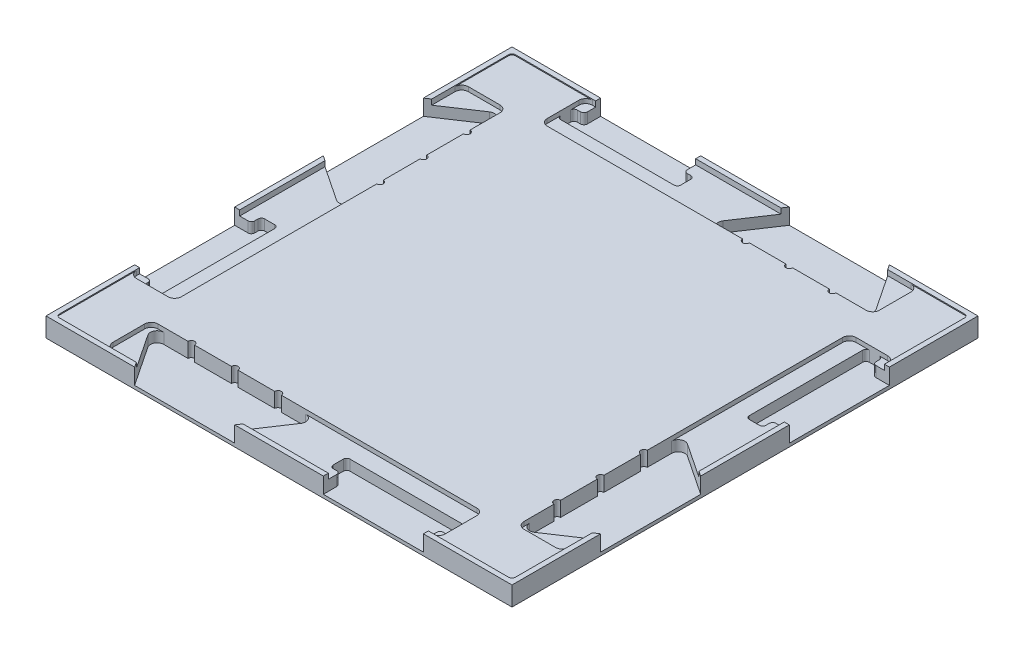
from build123d import *

# Parameters (mm, degrees)
SKETCH1_W           = 139.7
SKETCH1_H           = 139.7
BOSS_EXTRUDE1_DEPTH = 2.875
SKETCH2_W           = 136.7
SKETCH2_H           = 136.7
CUT_EXTRUDE1_DEPTH  = 0.3
CUT_EXTRUDE2_START  = -4.75
CUT_EXTRUDE2_DEPTH  = 104.700025265
CUT_EXTRUDE4_DEPTH  = 4.45
SKETCH9_W           = 99.566666666
SKETCH9_H           = 13.5
CUT_EXTRUDE5_DEPTH  = 1.3
FILLET1_R           = 1
FILLET3_R           = 2
FILLET4_R           = 2
CIRPATTERN1_START   = -1.875
CIRPATTERN1_DEPTH   = 4.75
CIRPATTERN1_START_2 = 1.275
CIRPATTERN1_2_DEPTH = 1.3


# Read off the part's stored shape, not the designer's step: CirPattern1
with BuildPart() as part:
    # Sketch1 → Boss-Extrude1 (new, symmetric)
    with BuildSketch(Plane(origin=(0, 0, 0), x_dir=(1, 0, 0), z_dir=(0, 1, 0))):
        Rectangle(SKETCH1_W, SKETCH1_H)
    extrude(amount=BOSS_EXTRUDE1_DEPTH, both=True)

    # Sketch2 → Cut-Extrude1 (cut)
    with BuildSketch(Plane(origin=(0, 2.875, 0), x_dir=(1, 0, 0), z_dir=(0, 1, 0))):
        Rectangle(SKETCH2_W, SKETCH2_H)
    extrude(amount=-CUT_EXTRUDE1_DEPTH, mode=Mode.SUBTRACT)

    # Sketch4 → Cut-Extrude2 (cut)
    with BuildSketch(Plane(origin=(0, 2.875, 0), x_dir=(1, 0, 0), z_dir=(0, 1, 0)).offset(CUT_EXTRUDE2_START)):
        Polygon((-43.283333333, -69.85), (-53.283333333, -54.85), (-3.283333333, -54.85), (-13.283333333, -69.85), align=None)
        Polygon((13.283333333, -69.85), (13.283333333, -64.85), (10.283333333, -64.85), (10.283333333, -59.85), (46.283333333, -59.85), (46.283333333, -64.85), (43.283333333, -64.85), (43.283333333, -69.85), align=None)
    extrude(amount=CUT_EXTRUDE2_DEPTH, mode=Mode.SUBTRACT)

    # Sketch6 → Cut-Extrude4 (cut)
    with BuildSketch(Plane(origin=(0, 2.575, 0), x_dir=(1, 0, 0), z_dir=(0, 1, 0))):
        with BuildLine():
            Line((-42.283333333, -54.85), (-40.283333333, -54.85))
            ThreePointArc((-40.283333333, -54.85), (-41.283333333, -53.85), (-42.283333333, -54.85))
        make_face()
        with BuildLine():
            Line((-29.283333333, -54.85), (-27.283333333, -54.85))
            ThreePointArc((-27.283333333, -54.85), (-28.283333333, -53.85), (-29.283333333, -54.85))
        make_face()
        with BuildLine():
            Line((-16.283333333, -54.85), (-14.283333333, -54.85))
            ThreePointArc((-14.283333333, -54.85), (-15.283333333, -53.85), (-16.283333333, -54.85))
        make_face()
    extrude(amount=-CUT_EXTRUDE4_DEPTH, mode=Mode.SUBTRACT)

    # Sketch9 → Cut-Extrude5 (cut)
    with BuildSketch(Plane(origin=(0, 2.575, 0), x_dir=(1, 0, 0), z_dir=(0, 1, 0))):
        with Locations((-3.5, -61.6)):
            Rectangle(SKETCH9_W, SKETCH9_H)
    extrude(amount=-CUT_EXTRUDE5_DEPTH, mode=Mode.SUBTRACT)

    # Fillet1
    fillet1_edges = [part.edges().sort_by_distance(p)[0] for p in [
        (-68.35, 2.725, -68.35),
        (-68.35, 2.725, 68.35),
        (68.35, 2.725, 68.35),
        (68.35, 2.725, -68.35),
        (46.283333333, -0.3, 64.85),
        (46.283333333, -0.3, 59.85),
        (10.283333333, -0.3, 59.85),
        (10.283333333, -0.3, 64.85),
        (13.283333333, -0.3, 64.85),
        (43.283333333, -0.3, 64.85),
    ]]
    fillet(fillet1_edges, radius=FILLET1_R)

    # Fillet3
    fillet3_edges = [part.edges().sort_by_distance(p)[0] for p in [
        (-53.283333333, -0.3, 54.85),
        (-3.283333333, -0.3, 54.85),
    ]]
    fillet(fillet3_edges, radius=FILLET3_R)

    # Fillet4
    fillet4_edges = [part.edges().sort_by_distance(p)[0] for p in [
        (46.283333333, 1.925, 54.85),
        (46.283333333, 1.925, 68.35),
        (-53.283333333, 1.925, 54.85),
        (-53.283333333, 1.925, 68.35),
    ]]
    fillet(fillet4_edges, radius=FILLET4_R)

    # CirPattern1 outline → CirPattern1 (cut)
    with BuildSketch(Plane(origin=(0, 0, 0), x_dir=(1, 0, 0), z_dir=(0, 1, 0)).offset(CIRPATTERN1_START)):
        with BuildLine():
            ThreePointArc((54.85, -14.283333333), (53.85, -15.283333333), (54.85, -16.283333333))
            Line((54.85, -16.283333333), (54.85, -27.283333333))
            ThreePointArc((54.85, -27.283333333), (53.85, -28.283333333), (54.85, -29.283333333))
            Line((54.85, -29.283333333), (54.85, -40.283333333))
            ThreePointArc((54.85, -40.283333333), (53.85, -41.283333333), (54.85, -42.283333333))
            Line((54.85, -42.283333333), (54.85, -49.54629915))
            ThreePointArc((54.85, -49.54629915), (55.906284149, -51.309648347), (57.959400392, -51.210399738))
            Line((57.959400392, -51.210399738), (69.85, -43.283333333))
            Line((69.85, -43.283333333), (69.85, -13.283333333))
            Line((69.85, -13.283333333), (57.959400392, -5.356266928))
            ThreePointArc((57.959400392, -5.356266928), (55.906284149, -5.257018319), (54.85, -7.020367517))
            Line((54.85, -7.020367517), (54.85, -14.283333333))
        make_face()
        with BuildLine():
            Line((-69.85, 43.283333333), (-69.85, 13.283333333))
            Line((-69.85, 13.283333333), (-57.959400392, 5.356266928))
            ThreePointArc((-57.959400392, 5.356266928), (-55.906284149, 5.257018319), (-54.85, 7.020367517))
            Line((-54.85, 7.020367517), (-54.85, 14.283333333))
            ThreePointArc((-54.85, 14.283333333), (-53.85, 15.283333333), (-54.85, 16.283333333))
            Line((-54.85, 16.283333333), (-54.85, 27.283333333))
            ThreePointArc((-54.85, 27.283333333), (-53.85, 28.283333333), (-54.85, 29.283333333))
            Line((-54.85, 29.283333333), (-54.85, 40.283333333))
            ThreePointArc((-54.85, 40.283333333), (-53.85, 41.283333333), (-54.85, 42.283333333))
            Line((-54.85, 42.283333333), (-54.85, 49.54629915))
            ThreePointArc((-54.85, 49.54629915), (-55.906284149, 51.309648347), (-57.959400392, 51.210399738))
            Line((-57.959400392, 51.210399738), (-69.85, 43.283333333))
        make_face()
        with BuildLine():
            Line((43.283333333, 69.85), (13.283333333, 69.85))
            Line((13.283333333, 69.85), (5.356266928, 57.959400392))
            ThreePointArc((5.356266928, 57.959400392), (5.257018319, 55.906284149), (7.020367517, 54.85))
            Line((7.020367517, 54.85), (14.283333333, 54.85))
            ThreePointArc((14.283333333, 54.85), (15.283333333, 53.85), (16.283333333, 54.85))
            Line((16.283333333, 54.85), (27.283333333, 54.85))
            ThreePointArc((27.283333333, 54.85), (28.283333333, 53.85), (29.283333333, 54.85))
            Line((29.283333333, 54.85), (40.283333333, 54.85))
            ThreePointArc((40.283333333, 54.85), (41.283333333, 53.85), (42.283333333, 54.85))
            Line((42.283333333, 54.85), (49.54629915, 54.85))
            ThreePointArc((49.54629915, 54.85), (51.309648347, 55.906284149), (51.210399738, 57.959400392))
            Line((51.210399738, 57.959400392), (43.283333333, 69.85))
        make_face()
        with BuildLine():
            Line((63.85, 46.283333333), (60.85, 46.283333333))
            ThreePointArc((60.85, 46.283333333), (60.142893218, 45.990440115), (59.85, 45.283333333))
            Line((59.85, 45.283333333), (59.85, 11.283333333))
            ThreePointArc((59.85, 11.283333333), (60.142893219, 10.576226552), (60.85, 10.283333333))
            Line((60.85, 10.283333333), (63.85, 10.283333333))
            ThreePointArc((63.85, 10.283333333), (64.557106781, 10.576226552), (64.85, 11.283333333))
            Line((64.85, 11.283333333), (64.85, 12.283333333))
            ThreePointArc((64.85, 12.283333333), (65.142893218, 12.990440114), (65.85, 13.283333333))
            Line((65.85, 13.283333333), (69.85, 13.283333333))
            Line((69.85, 13.283333333), (69.85, 43.283333333))
            Line((69.85, 43.283333333), (65.85, 43.283333333))
            ThreePointArc((65.85, 43.283333333), (65.142893219, 43.576226552), (64.85, 44.283333333))
            Line((64.85, 44.283333333), (64.85, 45.283333333))
            ThreePointArc((64.85, 45.283333333), (64.557106781, 45.990440115), (63.85, 46.283333333))
        make_face()
        with BuildLine():
            Line((-13.283333333, 69.85), (-43.283333333, 69.85))
            Line((-43.283333333, 69.85), (-43.283333333, 65.85))
            ThreePointArc((-43.283333333, 65.85), (-43.576226552, 65.142893219), (-44.283333333, 64.85))
            Line((-44.283333333, 64.85), (-45.283333333, 64.85))
            ThreePointArc((-45.283333333, 64.85), (-45.990440115, 64.557106781), (-46.283333333, 63.85))
            Line((-46.283333333, 63.85), (-46.283333333, 60.85))
            ThreePointArc((-46.283333333, 60.85), (-45.990440115, 60.142893218), (-45.283333333, 59.85))
            Line((-45.283333333, 59.85), (-11.283333333, 59.85))
            ThreePointArc((-11.283333333, 59.85), (-10.576226552, 60.142893219), (-10.283333333, 60.85))
            Line((-10.283333333, 60.85), (-10.283333333, 63.85))
            ThreePointArc((-10.283333333, 63.85), (-10.576226552, 64.557106781), (-11.283333333, 64.85))
            Line((-11.283333333, 64.85), (-12.283333333, 64.85))
            ThreePointArc((-12.283333333, 64.85), (-12.990440114, 65.142893218), (-13.283333333, 65.85))
            Line((-13.283333333, 65.85), (-13.283333333, 69.85))
        make_face()
        with BuildLine():
            Line((-69.85, -13.283333333), (-69.85, -43.283333333))
            Line((-69.85, -43.283333333), (-65.85, -43.283333333))
            ThreePointArc((-65.85, -43.283333333), (-65.142893219, -43.576226552), (-64.85, -44.283333333))
            Line((-64.85, -44.283333333), (-64.85, -45.283333333))
            ThreePointArc((-64.85, -45.283333333), (-64.557106781, -45.990440115), (-63.85, -46.283333333))
            Line((-63.85, -46.283333333), (-60.85, -46.283333333))
            ThreePointArc((-60.85, -46.283333333), (-60.142893218, -45.990440115), (-59.85, -45.283333333))
            Line((-59.85, -45.283333333), (-59.85, -11.283333333))
            ThreePointArc((-59.85, -11.283333333), (-60.142893219, -10.576226552), (-60.85, -10.283333333))
            Line((-60.85, -10.283333333), (-63.85, -10.283333333))
            ThreePointArc((-63.85, -10.283333333), (-64.557106781, -10.576226552), (-64.85, -11.283333333))
            Line((-64.85, -11.283333333), (-64.85, -12.283333333))
            ThreePointArc((-64.85, -12.283333333), (-65.142893218, -12.990440114), (-65.85, -13.283333333))
            Line((-65.85, -13.283333333), (-69.85, -13.283333333))
        make_face()
    extrude(amount=CIRPATTERN1_DEPTH, mode=Mode.SUBTRACT)

    # CirPattern1 2 outline → CirPattern1 2 (cut)
    with BuildSketch(Plane(origin=(0, 0, 0), x_dir=(1, 0, 0), z_dir=(0, 1, 0)).offset(CIRPATTERN1_START_2)):
        with BuildLine():
            Line((54.85, 44.283333333), (54.85, -7.020367517))
            ThreePointArc((54.85, -7.020367517), (55.906284149, -5.257018319), (57.959400392, -5.356266928))
            Line((57.959400392, -5.356266928), (68.35, -12.283333333))
            Line((68.35, -12.283333333), (68.35, 13.283333333))
            Line((68.35, 13.283333333), (65.85, 13.283333333))
            ThreePointArc((65.85, 13.283333333), (65.142893218, 12.990440114), (64.85, 12.283333333))
            Line((64.85, 12.283333333), (64.85, 11.283333333))
            ThreePointArc((64.85, 11.283333333), (64.557106781, 10.576226552), (63.85, 10.283333333))
            Line((63.85, 10.283333333), (60.85, 10.283333333))
            ThreePointArc((60.85, 10.283333333), (60.142893219, 10.576226552), (59.85, 11.283333333))
            Line((59.85, 11.283333333), (59.85, 45.283333333))
            ThreePointArc((59.85, 45.283333333), (60.142893218, 45.990440115), (60.85, 46.283333333))
            Line((60.85, 46.283333333), (56.85, 46.283333333))
            ThreePointArc((56.85, 46.283333333), (55.435786438, 45.697546896), (54.85, 44.283333333))
        make_face()
        with BuildLine():
            ThreePointArc((57.959400392, -51.210399738), (55.906284149, -51.309648347), (54.85, -49.54629915))
            Line((54.85, -49.54629915), (54.85, -51.283333333))
            ThreePointArc((54.85, -51.283333333), (55.435786438, -52.697546896), (56.85, -53.283333333))
            Line((56.85, -53.283333333), (66.35, -53.283333333))
            ThreePointArc((66.35, -53.283333333), (67.764213562, -52.697546896), (68.35, -51.283333333))
            Line((68.35, -51.283333333), (68.35, -44.283333333))
            Line((68.35, -44.283333333), (57.959400392, -51.210399738))
        make_face()
        with BuildLine():
            Line((66.35, 46.283333333), (63.85, 46.283333333))
            ThreePointArc((63.85, 46.283333333), (64.557106781, 45.990440115), (64.85, 45.283333333))
            Line((64.85, 45.283333333), (64.85, 44.283333333))
            ThreePointArc((64.85, 44.283333333), (65.142893219, 43.576226552), (65.85, 43.283333333))
            Line((65.85, 43.283333333), (68.35, 43.283333333))
            Line((68.35, 43.283333333), (68.35, 44.283333333))
            ThreePointArc((68.35, 44.283333333), (67.764213562, 45.697546896), (66.35, 46.283333333))
        make_face()
        with BuildLine():
            Line((51.283333333, 68.35), (44.283333333, 68.35))
            Line((44.283333333, 68.35), (51.210399738, 57.959400392))
            ThreePointArc((51.210399738, 57.959400392), (51.309648347, 55.906284149), (49.54629915, 54.85))
            Line((49.54629915, 54.85), (51.283333333, 54.85))
            ThreePointArc((51.283333333, 54.85), (52.697546896, 55.435786438), (53.283333333, 56.85))
            Line((53.283333333, 56.85), (53.283333333, 66.35))
            ThreePointArc((53.283333333, 66.35), (52.697546896, 67.764213562), (51.283333333, 68.35))
        make_face()
        with BuildLine():
            Line((5.356266928, 57.959400392), (12.283333333, 68.35))
            Line((12.283333333, 68.35), (-13.283333333, 68.35))
            Line((-13.283333333, 68.35), (-13.283333333, 65.85))
            ThreePointArc((-13.283333333, 65.85), (-12.990440114, 65.142893218), (-12.283333333, 64.85))
            Line((-12.283333333, 64.85), (-11.283333333, 64.85))
            ThreePointArc((-11.283333333, 64.85), (-10.576226552, 64.557106781), (-10.283333333, 63.85))
            Line((-10.283333333, 63.85), (-10.283333333, 60.85))
            ThreePointArc((-10.283333333, 60.85), (-10.576226552, 60.142893219), (-11.283333333, 59.85))
            Line((-11.283333333, 59.85), (-45.283333333, 59.85))
            ThreePointArc((-45.283333333, 59.85), (-45.990440115, 60.142893218), (-46.283333333, 60.85))
            Line((-46.283333333, 60.85), (-46.283333333, 56.85))
            ThreePointArc((-46.283333333, 56.85), (-45.697546896, 55.435786438), (-44.283333333, 54.85))
            Line((-44.283333333, 54.85), (7.020367517, 54.85))
            ThreePointArc((7.020367517, 54.85), (5.257018319, 55.906284149), (5.356266928, 57.959400392))
        make_face()
        with BuildLine():
            Line((-43.283333333, 65.85), (-43.283333333, 68.35))
            Line((-43.283333333, 68.35), (-44.283333333, 68.35))
            ThreePointArc((-44.283333333, 68.35), (-45.697546896, 67.764213562), (-46.283333333, 66.35))
            Line((-46.283333333, 66.35), (-46.283333333, 63.85))
            ThreePointArc((-46.283333333, 63.85), (-45.990440115, 64.557106781), (-45.283333333, 64.85))
            Line((-45.283333333, 64.85), (-44.283333333, 64.85))
            ThreePointArc((-44.283333333, 64.85), (-43.576226552, 65.142893219), (-43.283333333, 65.85))
        make_face()
        with BuildLine():
            Line((-68.35, 51.283333333), (-68.35, 44.283333333))
            Line((-68.35, 44.283333333), (-57.959400392, 51.210399738))
            ThreePointArc((-57.959400392, 51.210399738), (-55.906284149, 51.309648347), (-54.85, 49.54629915))
            Line((-54.85, 49.54629915), (-54.85, 51.283333333))
            ThreePointArc((-54.85, 51.283333333), (-55.435786438, 52.697546896), (-56.85, 53.283333333))
            Line((-56.85, 53.283333333), (-66.35, 53.283333333))
            ThreePointArc((-66.35, 53.283333333), (-67.764213562, 52.697546896), (-68.35, 51.283333333))
        make_face()
        with BuildLine():
            Line((-57.959400392, 5.356266928), (-68.35, 12.283333333))
            Line((-68.35, 12.283333333), (-68.35, -13.283333333))
            Line((-68.35, -13.283333333), (-65.85, -13.283333333))
            ThreePointArc((-65.85, -13.283333333), (-65.142893218, -12.990440114), (-64.85, -12.283333333))
            Line((-64.85, -12.283333333), (-64.85, -11.283333333))
            ThreePointArc((-64.85, -11.283333333), (-64.557106781, -10.576226552), (-63.85, -10.283333333))
            Line((-63.85, -10.283333333), (-60.85, -10.283333333))
            ThreePointArc((-60.85, -10.283333333), (-60.142893219, -10.576226552), (-59.85, -11.283333333))
            Line((-59.85, -11.283333333), (-59.85, -45.283333333))
            ThreePointArc((-59.85, -45.283333333), (-60.142893218, -45.990440115), (-60.85, -46.283333333))
            Line((-60.85, -46.283333333), (-56.85, -46.283333333))
            ThreePointArc((-56.85, -46.283333333), (-55.435786438, -45.697546896), (-54.85, -44.283333333))
            Line((-54.85, -44.283333333), (-54.85, 7.020367517))
            ThreePointArc((-54.85, 7.020367517), (-55.906284149, 5.257018319), (-57.959400392, 5.356266928))
        make_face()
        with BuildLine():
            Line((-65.85, -43.283333333), (-68.35, -43.283333333))
            Line((-68.35, -43.283333333), (-68.35, -44.283333333))
            ThreePointArc((-68.35, -44.283333333), (-67.764213562, -45.697546896), (-66.35, -46.283333333))
            Line((-66.35, -46.283333333), (-63.85, -46.283333333))
            ThreePointArc((-63.85, -46.283333333), (-64.557106781, -45.990440115), (-64.85, -45.283333333))
            Line((-64.85, -45.283333333), (-64.85, -44.283333333))
            ThreePointArc((-64.85, -44.283333333), (-65.142893219, -43.576226552), (-65.85, -43.283333333))
        make_face()
    extrude(amount=CIRPATTERN1_2_DEPTH, mode=Mode.SUBTRACT)


solid = part.part
